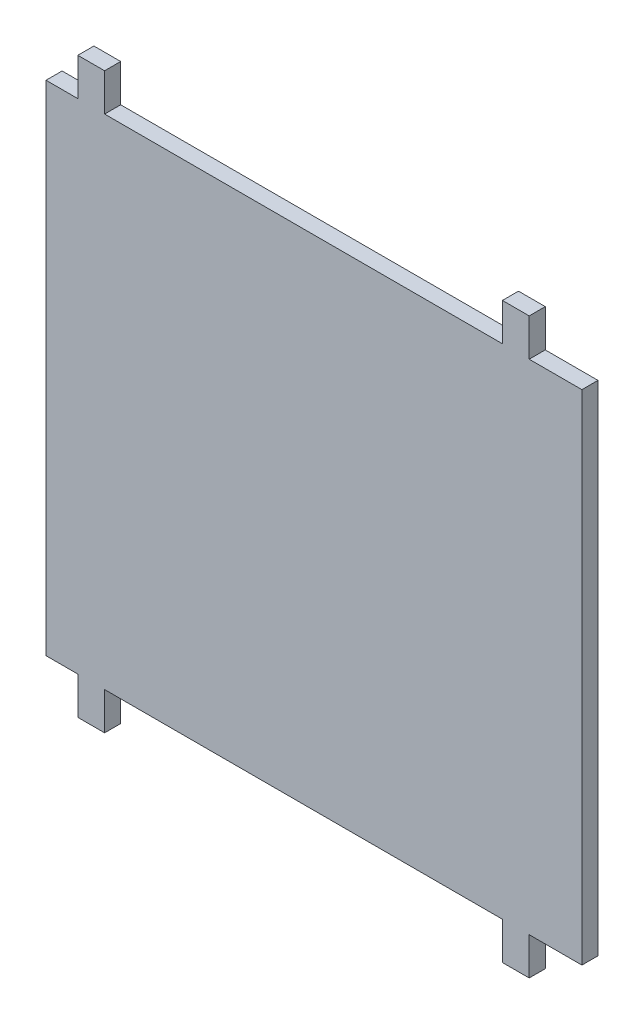
from build123d import *

# Parameters (mm, degrees)
SKETCH1_W                     = 100
SKETCH1_H                     = 107
BOSS_EXTRUDE1_DEPTH           = 3
CUT_EXTRUDE_THIN2_START       = -3
CUT_EXTRUDE_THIN2_OUTLINE_W   = 5.933508572
CUT_EXTRUDE_THIN2_OUTLINE_H   = 7
CUT_EXTRUDE_THIN2_OUTLINE_W_2 = 74.23028827
CUT_EXTRUDE_THIN2_OUTLINE_W_3 = 9.836203158
CUT_EXTRUDE_THIN2_DEPTH       = 3


# Read off the part's stored shape, not the designer's step: Cut-Extrude-Thin2
with BuildPart() as part:
    # Sketch1 → Boss-Extrude1 (new body)
    with BuildSketch(Plane.XY):
        with Locations((50, -53.5)):
            Rectangle(SKETCH1_W, SKETCH1_H)
    extrude(amount=BOSS_EXTRUDE1_DEPTH)

    # Cut-Extrude-Thin2 outline → Cut-Extrude-Thin2 (cut)
    with BuildSketch(Plane.XY.offset(3).offset(CUT_EXTRUDE_THIN2_START)):
        with Locations((2.966754286, -103.5)):
            Rectangle(CUT_EXTRUDE_THIN2_OUTLINE_W, CUT_EXTRUDE_THIN2_OUTLINE_H)
        with Locations((48.048652707, -103.5)):
            Rectangle(CUT_EXTRUDE_THIN2_OUTLINE_W_2, CUT_EXTRUDE_THIN2_OUTLINE_H)
        with Locations((2.966754286, -3.5)):
            Rectangle(CUT_EXTRUDE_THIN2_OUTLINE_W, CUT_EXTRUDE_THIN2_OUTLINE_H)
        with Locations((95.081898421, -103.5)):
            Rectangle(CUT_EXTRUDE_THIN2_OUTLINE_W_3, CUT_EXTRUDE_THIN2_OUTLINE_H)
        with Locations((48.048652707, -3.5)):
            Rectangle(CUT_EXTRUDE_THIN2_OUTLINE_W_2, CUT_EXTRUDE_THIN2_OUTLINE_H)
        with Locations((95.081898421, -3.5)):
            Rectangle(CUT_EXTRUDE_THIN2_OUTLINE_W_3, CUT_EXTRUDE_THIN2_OUTLINE_H)
    extrude(amount=CUT_EXTRUDE_THIN2_DEPTH, mode=Mode.SUBTRACT)


solid = part.part
